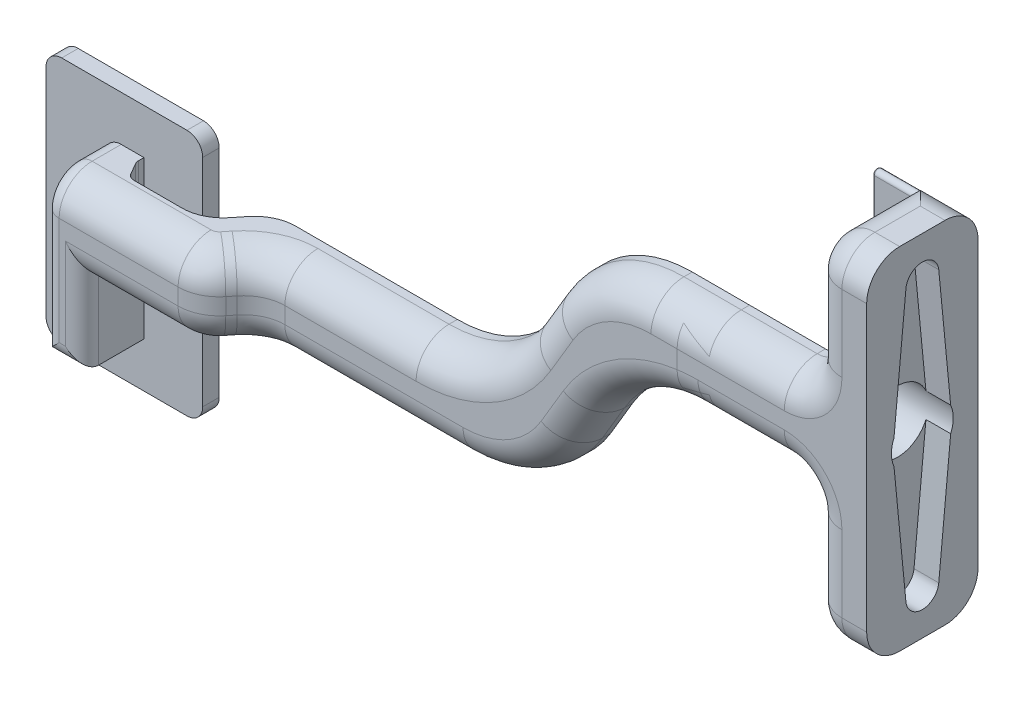
from build123d import *
from build123d.topology import SkipClean

# Parameters (mm, degrees)
BOSS_EXTRUDE1_DEPTH      = 2
FILLET1_R                = 1.9049999999999998
BOSS_EXTRUDE2_DEPTH      = 7.525
BOSS_EXTRUDE5_REACH      = 22.149
CUT_EXTRUDE1_DEPTH       = 92.3434023772244
BOSS_EXTRUDE6_DEPTH      = 7
SKETCH13_R               = 2.000000000000005
SKETCH13_R_2             = 3.749999999999999
SKETCH13_R_3             = 2.000000000000001
CUT_EXTRUDE2_DEPTH       = 3
SKETCH13_3_R             = 3.749999999999999
CUT_EXTRUDE3_DEPTH       = 17
FILLET2_R                = 4
FILLET3_R                = 15
FILLET4_R                = 3
FILLET5_R                = 5
CHAMFER1_SIZE            = 1.2
CHAMFER1_SIZE2           = 2.078460969082664
FILLET8_R                = 1
FILLET9_SIZE             = 3
FILLET9_SIZE2            = 1
BOSS_EXTRUDE7_DEPTH      = 4
FILLET10_R               = 4
FILLET11_R               = 2
FILLET12_R               = 0.5
FILLET13_R               = 0.2
SURFACE_EXTRUDE1_1_BACK  = 16
SURFACE_EXTRUDE1_1_DEPTH = 32
SURFACE_EXTRUDE1_2_BACK  = 16
SURFACE_EXTRUDE1_2_DEPTH = 32


with BuildPart() as part:
    # Sketch1 → Boss-Extrude1 (new body)
    with BuildSketch(Plane.XY):
        Polygon((-9.500000000000002, 14.999999999999998), (9.499999999999998, 14.999999999999998), (9.500000000000002, -15.000000000000002), (-9.499999999999998, -15.000000000000002), align=None)
    extrude(amount=BOSS_EXTRUDE1_DEPTH)

    # Fillet1
    fillet1_edges = [part.edges().sort_by_distance(p)[0] for p in [
        (9.500000000000002, -15.000000000000002, 1),
        (-9.499999999999998, -15.000000000000002, 1),
        (-9.500000000000002, 14.999999999999998, 1),
        (9.499999999999998, 14.999999999999998, 1),
    ]]
    fillet(fillet1_edges, radius=FILLET1_R)

    # Sketch2 → Boss-Extrude2 (add)
    with BuildSketch(Plane.XY.offset(2)):
        Polygon((-2.381250000000002, 9.525), (2.3812499999999983, 9.525), (2.381250000000001, -9.525), (-2.3812499999999983, -9.525), align=None)
    extrude(amount=BOSS_EXTRUDE2_DEPTH)

    # Boss-Extrude5: up to this face of the body (flat: up to its plane)
    boss_extrude5_end = Plane(part.part.faces().sort_by_distance((0, 0, 0))[0])
    # Sketch9 → Boss-Extrude5 (add, up to the picked face)
    with BuildSketch(Plane.XY.offset(9.525), mode=Mode.PRIVATE) as boss_extrude5_sk1:
        Polygon((-2.381250000000002, 9.525), (46.92195401298758, 9.525), (58.31942869093717, 28.750000000000316), (86.0162246779496, 28.750000000000316), (86.0162246779496, 18.750000000000316), (64.0162246779496, 18.750000000000316), (52.61875, -0.47499999999999976), (-2.381250000000002, -0.47499999999999976), align=None)
    boss_extrude5_tool1 = split(extrude(boss_extrude5_sk1.sketch, amount=-BOSS_EXTRUDE5_REACH, mode=Mode.PRIVATE), bisect_by=boss_extrude5_end, keep=Keep.BOTH, mode=Mode.PRIVATE)
    add(boss_extrude5_tool1.solids().sort_by(Axis((22.270352, 8.593968, 9.525), (0, 0, -1)))[0])

    # Sketch10 → Cut-Extrude1 (cut, through all)
    with BuildSketch(Plane.XZ.offset(0.47499999999999976)):
        Polygon((2.381250000000001, 5), (12.381250000000001, 5), (16.38125, 0), (9.500000000000002, 0), (9.500000000000002, 2), (2.381250000000001, 2), align=None)
        Polygon((16.44499908491942, 9.525), (20.064999084919418, 5), (86.0162246779496, 4.9999999999999725), (86.0162246779496, 9.525), align=None)
    extrude(amount=-CUT_EXTRUDE1_DEPTH, mode=Mode.SUBTRACT)

    # Sketch12 → Boss-Extrude6 (add)
    with BuildSketch(Plane(origin=(86.0162246779496, 0, 0), x_dir=(0, 0, -1), z_dir=(1, 0, 0))):
        Polygon((8.500000000000028, 45.00000000000033), (-4.9999999999999725, 45.00000000000033), (-4.999999999999968, 2.500000000000309), (8.500000000000037, 2.5000000000003144), align=None)
    extrude(amount=BOSS_EXTRUDE6_DEPTH)

    # Sketch13 → Cut-Extrude2 (cut)
    with BuildSketch(Plane(origin=(93.0162246779496, 0, 0), x_dir=(0, 0, -1), z_dir=(1, 0, 0))):
        with Locations((1.750000000000028, 40.00000000000031)):
            Circle(SKETCH13_R)
        with BuildLine():
            Line((-0.24069786841169175, 40.192670694972385), (-1.6869317712168508, 25.250000000000316))
            ThreePointArc((-1.6869317712168508, 25.250000000000316), (1.7500000000000282, 27.500000000000316), (5.186931771216907, 25.250000000000316))
            Line((5.186931771216907, 25.250000000000316), (3.740697868411748, 40.192670694972385))
            ThreePointArc((3.7406978684117558, 40.192670694972385), (3.747673113502771, 40.09644755874742), (3.750000000000033, 40.00000000000031))
            ThreePointArc((3.750000000000033, 40.00000000000031), (1.6535524412529192, 38.00232688649757), (-0.24069786841170004, 40.192670694972385))
        make_face()
        with Locations((1.750000000000028, 23.750000000000316)):
            Circle(SKETCH13_R_2)
        with BuildLine():
            Line((-1.6869317712168515, 22.250000000000316), (-0.24069786841169563, 7.307329305028252))
            ThreePointArc((-0.24069786841169694, 7.307329305028252), (1.6535524412529239, 9.497673113503057), (3.750000000000029, 7.500000000000317))
            ThreePointArc((3.750000000000029, 7.500000000000316), (3.747673113502767, 7.403552441253212), (3.740697868411753, 7.307329305028252))
            Line((3.740697868411752, 7.307329305028252), (5.186931771216907, 22.250000000000316))
            ThreePointArc((5.186931771216907, 22.250000000000316), (1.7500000000000273, 20.000000000000316), (-1.6869317712168512, 22.250000000000316))
        make_face()
        with Locations((1.750000000000028, 7.500000000000317)):
            Circle(SKETCH13_R_3)
    extrude(amount=-CUT_EXTRUDE2_DEPTH, mode=Mode.SUBTRACT)

    # Sketch13<3> → Cut-Extrude3 (cut)
    with BuildSketch(Plane(origin=(93.0162246779496, 0, 0), x_dir=(0, 0, -1), z_dir=(1, 0, 0))):
        with Locations(Location((1.750000000000028, 23.750000000000316, 0), (0, 0, 336.421821522))):
            Circle(SKETCH13_3_R)
    extrude(amount=-CUT_EXTRUDE3_DEPTH, mode=Mode.SUBTRACT)

    # Fillet2
    fillet2_edges = [part.edges().sort_by_distance(p)[0] for p in [
        (89.5162246779496, 2.5000000000003144, -8.500000000000037),
        (89.5162246779496, 45.00000000000033, -8.500000000000028),
        (89.5162246779496, 45.00000000000033, 4.9999999999999725),
        (89.5162246779496, 2.500000000000309, 4.999999999999968),
    ]]
    fillet(fillet2_edges, radius=FILLET2_R)

    # Fillet3
    fillet3_edges = [part.edges().sort_by_distance(p)[0] for p in [
        (52.61875, -0.47499999999999976, 2.499999999999993),
        (46.92195401298758, 9.525, 2.4999999999999947),
        (58.31942869093717, 28.750000000000316, 2.499999999999992),
        (64.0162246779496, 18.750000000000316, 2.499999999999991),
    ]]
    fillet(fillet3_edges, radius=FILLET3_R)

    # Fillet4
    fillet4_edges = [part.edges().sort_by_distance(p)[0] for p in [
        (86.0162246779496, 28.750000000000316, 2.499999999999986),
        (86.0162246779496, 18.750000000000316, 2.499999999999986),
    ]]
    fillet(fillet4_edges, radius=FILLET4_R)

    # Fillet5
    fillet5_edges = [part.edges().sort_by_distance(p)[0] for p in [
        (20.064999084919418, 4.525, 5),
        (16.44499908491942, 4.525, 9.525),
        (12.381250000000001, 4.525, 5),
        (16.38125, 4.525, 0),
    ]]
    fillet(fillet5_edges, radius=FILLET5_R)

    # Chamfer1
    chamfer1_edges = [part.edges().sort_by_distance(p)[0] for p in [
        (2.381250000000001, 4.525, 5),
    ]]
    chamfer1_side = [part.faces().sort_by_distance(p)[0] for p in [
        (6.179687881283577, 4.525, 5),
    ]]
    chamfer(chamfer1_edges, length=CHAMFER1_SIZE, length2=CHAMFER1_SIZE2, reference=chamfer1_side[0])

    # Fillet8
    fillet8_edges = [part.edges().sort_by_distance(p)[0] for p in [
        (2.3812499999999996, 4.525, 2.921539030917336),
        (3.58125, 4.525, 5),
    ]]
    fillet(fillet8_edges, radius=FILLET8_R)

    # Fillet9
    fillet9_edges = [part.edges().sort_by_distance(p)[0] for p in [
        (76.0162246779496, 23.750000000000316, 1.9999999999999711),
    ]]
    fillet9_side = [part.faces().sort_by_distance(p)[0] for p in [
        (84.5162246779496, 25.249999999994262, 1.6869317712194931),
    ]]
    chamfer(fillet9_edges, length=FILLET9_SIZE, length2=FILLET9_SIZE2, reference=fillet9_side[0])

    # Sketch17 → Boss-Extrude7 (add)
    with SkipClean():  # the faces are left unmerged after this step: merging them gives an invalid solid
        with BuildSketch(Plane.ZY.offset(-86.0162246779496)):
            with BuildLine():
                Line((-6.750000000000025, 44.30718913883107), (-6.750000000000021, 3.192810861169567))
                ThreePointArc((-6.750000000000021, 3.192810861169567), (-8.03553390593277, 4.629171306613339), (-8.500000000000037, 6.500000000000318))
                Line((-8.500000000000037, 6.500000000000318), (-8.500000000000028, 41.00000000000033))
                ThreePointArc((-8.500000000000028, 41.00000000000033), (-8.035533905932766, 42.8708286933873), (-6.750000000000025, 44.30718913883107))
            make_face()
        extrude(amount=BOSS_EXTRUDE7_DEPTH)

    # Fillet10
    # the kernel refuses this fillet: 4 mm, written as the material it takes off along each edge
    with BuildSketch(Plane(origin=(22.468123322352284, -0.47499999999999976, 9.999999999999968), x_dir=(0, 0, -1), z_dir=(1, 0, 0))) as fillet10_piece_1:
        with BuildLine():
            CenterArc((5 + FILLET10_R, FILLET10_R), FILLET10_R, 180, 90)
            Line((5, FILLET10_R), (5, 0))
            Line((5, 0), (5 + FILLET10_R, 1.1e-16))
        make_face()
    revolve(axis=Axis((22.468123322352284, -0.47499999999999976, 9.999999999999968), (0, 1, 0)), revolution_arc=51.34019174590992, mode=Mode.SUBTRACT)
    with BuildSketch(Plane(origin=(17.94621889470172, -0.47499999999999976, 7.648475237772124), x_dir=(-0.7808688094430306, 0, -0.624695047554424), z_dir=(0.624695047554424, 0, -0.7808688094430306))) as fillet10_piece_2:
        with BuildLine():
            CenterArc((FILLET10_R, FILLET10_R), FILLET10_R, 180, 90)
            Line((1.1e-16, FILLET10_R), (0, 0))
            Line((0, 0), (FILLET10_R, 0))
        make_face()
    extrude(amount=0.9885789600110632, mode=Mode.SUBTRACT)
    with BuildSketch(Plane(origin=(14.041874847486566, -0.47499999999999976, 4.525), x_dir=(0.7808688094430305, 0, 0.6246950475544238), z_dir=(0.6246950475544238, 0, -0.7808688094430305))) as fillet10_piece_3:
        with BuildLine():
            CenterArc((4.999999999999999 - FILLET10_R, -FILLET10_R), FILLET10_R, 6.36e-15, 90)
            Line((4.999999999999999, -FILLET10_R), (4.999999999999999, 0))
            Line((4.999999999999999, 0), (4.999999999999999 - FILLET10_R, -1.1e-16))
        make_face()
    revolve(axis=Axis((14.041874847486566, -0.47499999999999976, 4.525), (0, -1, 0)), revolution_arc=51.34019174590992, mode=Mode.SUBTRACT)
    with BuildSketch(Plane(origin=(14.041874847486568, -0.47499999999999976, 9.525), x_dir=(0, 3e-17, -1), z_dir=(-1, 0, 0))) as fillet10_piece_4:
        with BuildLine():
            CenterArc((FILLET10_R, -FILLET10_R), FILLET10_R, 90, 90)
            Line((1.1e-16, -FILLET10_R), (0, 0))
            Line((0, 0), (FILLET10_R, 0))
        make_face()
    extrude(amount=11.660624847486567, mode=Mode.SUBTRACT)
    with BuildSketch(Plane(origin=(86.0162246779496, 45.00000000000033, -14.500000000000028), x_dir=(0, -1, 0), z_dir=(0, 0, 1))) as fillet10_piece_5_section:
        with BuildLine():
            CenterArc((FILLET10_R, FILLET10_R), FILLET10_R, 180, 90)
            Line((0, FILLET10_R), (0, 0))
            Line((0, 0), (FILLET10_R, 0))
        make_face()
    fillet10_piece_5 = extrude(amount=15.5, mode=Mode.PRIVATE)
    fillet10_piece_5 = split(fillet10_piece_5, bisect_by=Plane(origin=(86.78360068895931, 43.962899663721885, -6.750000000000025), z_dir=(0, 9e-17, 1)), keep=Keep.TOP, mode=Mode.PRIVATE)
    add(fillet10_piece_5, mode=Mode.SUBTRACT)
    with BuildSketch(Plane(origin=(86.0162246779496, 2.500000000000311, 0.9999999999999662), x_dir=(0, 1, 3.9e-16), z_dir=(0, 3.9e-16, -1))) as fillet10_piece_6_section:
        with BuildLine():
            CenterArc((FILLET10_R, FILLET10_R), FILLET10_R, 180, 90)
            Line((1.78e-15, FILLET10_R), (0, 0))
            Line((0, 0), (FILLET10_R, 0))
        make_face()
    fillet10_piece_6 = extrude(amount=15.500000000000005, mode=Mode.PRIVATE)
    fillet10_piece_6 = split(fillet10_piece_6, bisect_by=Plane(origin=(86.78859371626301, 3.518701412405754, -6.750000000000021), z_dir=(0, 9e-17, 1)), keep=Keep.TOP, mode=Mode.PRIVATE)
    add(fillet10_piece_6, mode=Mode.SUBTRACT)
    with BuildSketch(Plane(origin=(86.0162246779496, 41.00000000000033, 4.9999999999999725), x_dir=(0, 1e-16, -1), z_dir=(0, -1, -1e-16))) as fillet10_piece_7:
        with BuildLine():
            CenterArc((FILLET10_R, FILLET10_R), FILLET10_R, 180, 90)
            Line((-8.9e-16, FILLET10_R), (0, 0))
            Line((0, 0), (FILLET10_R, 0))
        make_face()
    extrude(amount=9.25000000000001, mode=Mode.SUBTRACT)
    with BuildSketch(Plane(origin=(86.0162246779496, 15.750000000000316, 4.99999999999997), x_dir=(0, 1e-16, -1), z_dir=(0, -1, -1e-16))) as fillet10_piece_8:
        with BuildLine():
            CenterArc((FILLET10_R, FILLET10_R), FILLET10_R, 180, 90)
            Line((0, FILLET10_R), (0, 0))
            Line((0, 0), (FILLET10_R, 0))
        make_face()
    extrude(amount=9.250000000000004, mode=Mode.SUBTRACT)
    with BuildSketch(Plane(origin=(83.0162246779496, 15.750000000000316, 4.99999999999997), x_dir=(1, 0, 0), z_dir=(0, -1, 0))) as fillet10_piece_9:
        with BuildLine():
            CenterArc((3 + FILLET10_R, -FILLET10_R), FILLET10_R, 90, 90)
            Line((3 + FILLET10_R, 8.9e-16), (3, 0))
            Line((3, 0), (3, -FILLET10_R))
        make_face()
    revolve(axis=Axis((83.0162246779496, 15.750000000000316, 4.99999999999997), (0, 0, 1)), revolution_arc=90, mode=Mode.SUBTRACT)
    with BuildSketch(Plane(origin=(83.0162246779496, 18.750000000000316, 4.999999999999973), x_dir=(-4.2e-16, 0, -1), z_dir=(-1, 0, 4.2e-16))) as fillet10_piece_10:
        with BuildLine():
            CenterArc((FILLET10_R, -FILLET10_R), FILLET10_R, 90, 90)
            Line((0, -FILLET10_R), (0, 0))
            Line((0, 0), (FILLET10_R, 0))
        make_face()
    extrude(amount=10.454806019481367, mode=Mode.SUBTRACT)
    with BuildSketch(Plane(origin=(72.56141865846823, 3.750000000000316, 4.999999999999968), x_dir=(0, 1, 0), z_dir=(1, 0, 0))) as fillet10_piece_11:
        with BuildLine():
            CenterArc((15 + FILLET10_R, -FILLET10_R), FILLET10_R, 90, 90)
            Line((15 + FILLET10_R, 8.9e-16), (15, 0))
            Line((15, 0), (15, -FILLET10_R))
        make_face()
    revolve(axis=Axis((72.56141865846823, 3.750000000000316, 4.999999999999968), (0, 0, 1)), revolution_arc=59.3385647983699, mode=Mode.SUBTRACT)
    with BuildSketch(Plane(origin=(59.65848294237457, 11.399460759188168, 4.999999999999983), x_dir=(-3e-16, -7e-17, -1), z_dir=(-0.5099640506125234, -0.8601957144062436, 0))) as fillet10_piece_12:
        with BuildLine():
            CenterArc((FILLET10_R, -FILLET10_R), FILLET10_R, 90.00000000000001, 90)
            Line((2e-17, -FILLET10_R), (0, 0))
            Line((0, 0), (FILLET10_R, 0))
        make_face()
    extrude(amount=5.259177001943909, mode=Mode.SUBTRACT)
    with BuildSketch(Plane(origin=(22.468123322352287, -0.47499999999999976, 4.999999999999999), x_dir=(-4.2e-16, 3e-17, -1), z_dir=(1, 0, -4.2e-16))) as fillet10_piece_13:
        with BuildLine():
            CenterArc((FILLET10_R, FILLET10_R), FILLET10_R, 180.00000000000003, 90)
            Line((-7.8e-16, FILLET10_R), (0, 0))
            Line((0, 0), (FILLET10_R, 0))
        make_face()
    extrude(amount=21.605432697129086, mode=Mode.SUBTRACT)
    with BuildSketch(Plane(origin=(44.07355601948137, 14.524999999999997, 4.99999999999997), x_dir=(0.8601957144062434, -0.5099640506125236, 0), z_dir=(0.5099640506125236, 0.8601957144062434, 0))) as fillet10_piece_14:
        with BuildLine():
            CenterArc((15.000000000000002 - FILLET10_R, FILLET10_R), FILLET10_R, 269.99999999999994, 90.00000000000006)
            Line((15.000000000000002 - FILLET10_R, -8.9e-16), (15.000000000000002, 0))
            Line((15.000000000000002, 0), (15.000000000000004, FILLET10_R))
        make_face()
    revolve(axis=Axis((44.07355601948137, 14.524999999999997, 4.99999999999997), (0, 0, -1)), revolution_arc=59.3385647983699, mode=Mode.SUBTRACT)
    with BuildSketch(Plane(origin=(-12.381250000000001, 9.525, 9.525), x_dir=(0, 0, -1), z_dir=(1, 0, 0))) as fillet10_piece_15:
        with BuildLine():
            CenterArc((FILLET10_R, -FILLET10_R), FILLET10_R, 90, 90)
            Line((0, -FILLET10_R), (0, 0))
            Line((0, 0), (FILLET10_R, 0))
        make_face()
    extrude(amount=26.42312484748657, mode=Mode.SUBTRACT)
    with BuildSketch(Plane(origin=(18.563779275137136, 9.525, 6.876524762227854), x_dir=(-0.7808688094430307, 0, -0.624695047554424), z_dir=(-0.624695047554424, 0, 0.7808688094430306))) as fillet10_piece_16:
        with BuildLine():
            CenterArc((FILLET10_R, FILLET10_R), FILLET10_R, 180, 90)
            Line((5.5e-16, FILLET10_R), (0, 0))
            Line((0, 0), (FILLET10_R, 0))
        make_face()
    extrude(amount=0.9885789600110632, mode=Mode.SUBTRACT)
    with BuildSketch(Plane(origin=(14.041874847486566, 9.525, 4.525), x_dir=(0.7808688094430305, 0, 0.6246950475544238), z_dir=(0.6246950475544238, 0, -0.7808688094430305))) as fillet10_piece_17:
        with BuildLine():
            CenterArc((4.999999999999999 - FILLET10_R, FILLET10_R), FILLET10_R, 270, 90)
            Line((5.000000000000001, FILLET10_R), (4.999999999999999, 0))
            Line((4.999999999999999, 0), (4.999999999999999 - FILLET10_R, 0))
        make_face()
    revolve(axis=Axis((14.041874847486566, 9.525, 4.525), (0, -1, 0)), revolution_arc=51.34019174590992, mode=Mode.SUBTRACT)
    with BuildSketch(Plane(origin=(22.468123322352284, 9.525, 9.999999999999968), x_dir=(0, 0, -1), z_dir=(1, 0, 0))) as fillet10_piece_18:
        with BuildLine():
            CenterArc((5 + FILLET10_R, -FILLET10_R), FILLET10_R, 90, 90)
            Line((5, -FILLET10_R), (5, 0))
            Line((5, 0), (5 + FILLET10_R, 0))
        make_face()
    revolve(axis=Axis((22.468123322352284, 9.525, 9.999999999999968), (0, 1, 0)), revolution_arc=51.34019174590992, mode=Mode.SUBTRACT)
    with BuildSketch(Plane(origin=(38.376760032468965, 9.525, 4.999999999999992), x_dir=(-4.2e-16, 0, -1), z_dir=(-1, 0, 4.2e-16))) as fillet10_piece_19:
        with BuildLine():
            CenterArc((FILLET10_R, FILLET10_R), FILLET10_R, 179.99999999999997, 90)
            Line((8.9e-16, FILLET10_R), (0, 0))
            Line((0, 0), (FILLET10_R, 0))
        make_face()
    extrude(amount=15.908636710116681, mode=Mode.SUBTRACT)
    with BuildSketch(Plane(origin=(38.376760032468965, 24.525, 4.999999999999971), x_dir=(0.8601957144062434, -0.5099640506125236, 0), z_dir=(0.5099640506125236, 0.8601957144062434, 0))) as fillet10_piece_20:
        with BuildLine():
            CenterArc((15.000000000000002 + FILLET10_R, FILLET10_R), FILLET10_R, 180, 90)
            Line((15.000000000000002 + FILLET10_R, 8.9e-16), (15.000000000000002, 0))
            Line((15.000000000000002, 0), (15.000000000000002, FILLET10_R))
        make_face()
    revolve(axis=Axis((38.376760032468965, 24.525, 4.999999999999971), (0, 0, -1)), revolution_arc=59.3385647983699, mode=Mode.SUBTRACT)
    with BuildSketch(Plane(origin=(51.27969574856261, 16.87553924081215, 4.999999999999987), x_dir=(-5e-16, 5e-17, -1), z_dir=(0.5099640506125235, 0.8601957144062435, 0))) as fillet10_piece_21:
        with BuildLine():
            CenterArc((FILLET10_R, -FILLET10_R), FILLET10_R, 89.99999999999997, 90.00000000000003)
            Line((-9.2e-16, -FILLET10_R), (0, 0))
            Line((0, 0), (FILLET10_R, 0))
        make_face()
    extrude(amount=5.259177001943899, mode=Mode.SUBTRACT)
    with BuildSketch(Plane(origin=(66.86462267145579, 13.750000000000322, 4.99999999999997), x_dir=(0, 1, 0), z_dir=(1, 0, 0))) as fillet10_piece_22:
        with BuildLine():
            CenterArc((14.999999999999998 - FILLET10_R, -FILLET10_R), FILLET10_R, 0, 90)
            Line((14.999999999999998 - FILLET10_R, -8.9e-16), (14.999999999999998, 0))
            Line((14.999999999999998, 0), (14.999999999999998, -FILLET10_R))
        make_face()
    revolve(axis=Axis((66.86462267145579, 13.750000000000322, 4.99999999999997), (0, 0, 1)), revolution_arc=59.3385647983699, mode=Mode.SUBTRACT)
    with BuildSketch(Plane(origin=(83.0162246779496, 31.750000000000316, 4.999999999999972), x_dir=(0, -1, 0), z_dir=(-1, 0, 0))) as fillet10_piece_23:
        with BuildLine():
            CenterArc((3 + FILLET10_R, -FILLET10_R), FILLET10_R, 90, 90)
            Line((3 + FILLET10_R, -8.9e-16), (3, 0))
            Line((3, 0), (3, -FILLET10_R))
        make_face()
    revolve(axis=Axis((83.0162246779496, 31.750000000000316, 4.999999999999972), (0, 0, 1)), revolution_arc=90, mode=Mode.SUBTRACT)
    with BuildSketch(Plane(origin=(66.86462267145579, 28.750000000000316, 4.99999999999998), x_dir=(-4.2e-16, 0, -1), z_dir=(1, 0, -4.2e-16))) as fillet10_piece_24:
        with BuildLine():
            CenterArc((FILLET10_R, -FILLET10_R), FILLET10_R, 90, 90)
            Line((8.9e-16, -FILLET10_R), (0, 0))
            Line((0, 0), (FILLET10_R, 0))
        make_face()
    extrude(amount=16.151602006493803, mode=Mode.SUBTRACT)
    with BuildSketch(Plane(origin=(86.0162246779496, 41.00000000000033, 0.9999999999999725), x_dir=(0, 1, -1.9e-16), z_dir=(0, -1.9e-16, -1))) as fillet10_piece_25:
        with BuildLine():
            CenterArc((4 - FILLET10_R, FILLET10_R), FILLET10_R, 270, 90)
            Line((4, FILLET10_R), (4, 0))
            Line((4, 0), (4 - FILLET10_R, 0))
        make_face()
    revolve(axis=Axis((86.0162246779496, 41.00000000000033, 0.9999999999999725), (1, 0, 0)), revolution_arc=90, mode=Mode.SUBTRACT)
    with BuildSketch(Plane(origin=(86.0162246779496, 6.500000000000313, 0.999999999999968), x_dir=(0, 0, 1), z_dir=(0, 1, 0))) as fillet10_piece_26:
        with BuildLine():
            CenterArc((4 - FILLET10_R, FILLET10_R), FILLET10_R, 270, 90)
            Line((4, FILLET10_R), (4, 0))
            Line((4, 0), (4 - FILLET10_R, 0))
        make_face()
    revolve(axis=Axis((86.0162246779496, 6.500000000000313, 0.999999999999968), (1, 0, 0)), revolution_arc=90.00000000000003, mode=Mode.SUBTRACT)

    # Fillet11
    fillet11_edges = [part.edges().sort_by_distance(p)[0] for p in [
        (-2.3812499999999996, -2, 9.525),
        (-2.381250000000002, 9.525, 3.7625),
        (-2.3812500000000014, 8.35342712474619, 8.35342712474619),
        (1.33e-15, -9.525, 9.525),
        (2.3812500000000005, -5, 9.525),
    ]]
    fillet(fillet11_edges, radius=FILLET11_R)

    # Fillet12
    fillet12_edges = [part.edges().sort_by_distance(p)[0] for p in [
        (84.0162246779496, 44.30718913883107, -6.750000000000025),
        (84.0162246779496, 3.1928108611695674, -6.750000000000021),
    ]]
    fillet(fillet12_edges, radius=FILLET12_R)

    # Fillet13
    fillet13_edges = [part.edges().sort_by_distance(p)[0] for p in [
        (82.0162246779496, 23.75000000000032, -8.500000000000032),
        (82.0162246779496, 5.190692658584351, -8.279644730092304),
        (82.0162246779496, 23.75000000000032, -6.750000000000023),
        (82.0162246779496, 42.309307341416286, -8.279644730092299),
        (82.0162246779496, 43.63751910072297, -7.086336582323029),
        (82.0162246779496, 3.86248089927767, -7.086336582323025),
    ]]
    fillet(fillet13_edges, radius=FILLET13_R)


with BuildPart() as body_2:
    # Split1: the piece behind the surface
    add(part.part)
    # Surface-Extrude1: a surface, the sketch's curves swept straight by 32 mm
    with BuildLine(Plane.XY.offset(5.000000000000009).offset(-SURFACE_EXTRUDE1_1_BACK), mode=Mode.PRIVATE) as surface_extrude1_1_path:
        Line((73.81141865846824, 28.750000000000316), (73.81141865846824, 25.750000000000316))
        Line((73.81141865846824, 25.750000000000316), (70.03363720671818, 27.125000000000316))
        Line((70.03363720671818, 27.125000000000316), (70.03363720671818, 20.375000000000316))
        Line((70.03363720671818, 20.375000000000316), (73.81141865846824, 21.750000000000316))
        Line((73.81141865846824, 21.750000000000316), (73.81141865846824, 18.750000000000316))
    surface_extrude1_1 = Shell.extrude(surface_extrude1_1_path.wire(), (0 * SURFACE_EXTRUDE1_1_DEPTH, 0 * SURFACE_EXTRUDE1_1_DEPTH, 1 * SURFACE_EXTRUDE1_1_DEPTH))
    split(bisect_by=surface_extrude1_1, keep=Keep.BOTTOM)


with BuildPart() as part_1:
    add(part.part)

    # Split1: split by a surface, the side it looks to stays
    # Surface-Extrude1: a surface, the sketch's curves swept straight by 32 mm
    with BuildLine(Plane.XY.offset(5.000000000000009).offset(-SURFACE_EXTRUDE1_2_BACK), mode=Mode.PRIVATE) as surface_extrude1_2_path:
        Line((73.81141865846824, 28.750000000000316), (73.81141865846824, 25.750000000000316))
        Line((73.81141865846824, 25.750000000000316), (70.03363720671818, 27.125000000000316))
        Line((70.03363720671818, 27.125000000000316), (70.03363720671818, 20.375000000000316))
        Line((70.03363720671818, 20.375000000000316), (73.81141865846824, 21.750000000000316))
        Line((73.81141865846824, 21.750000000000316), (73.81141865846824, 18.750000000000316))
    surface_extrude1_2 = Shell.extrude(surface_extrude1_2_path.wire(), (0 * SURFACE_EXTRUDE1_2_DEPTH, 0 * SURFACE_EXTRUDE1_2_DEPTH, 1 * SURFACE_EXTRUDE1_2_DEPTH))
    split(bisect_by=surface_extrude1_2, keep=Keep.TOP)


solid = Compound([body_2.part, part_1.part])
